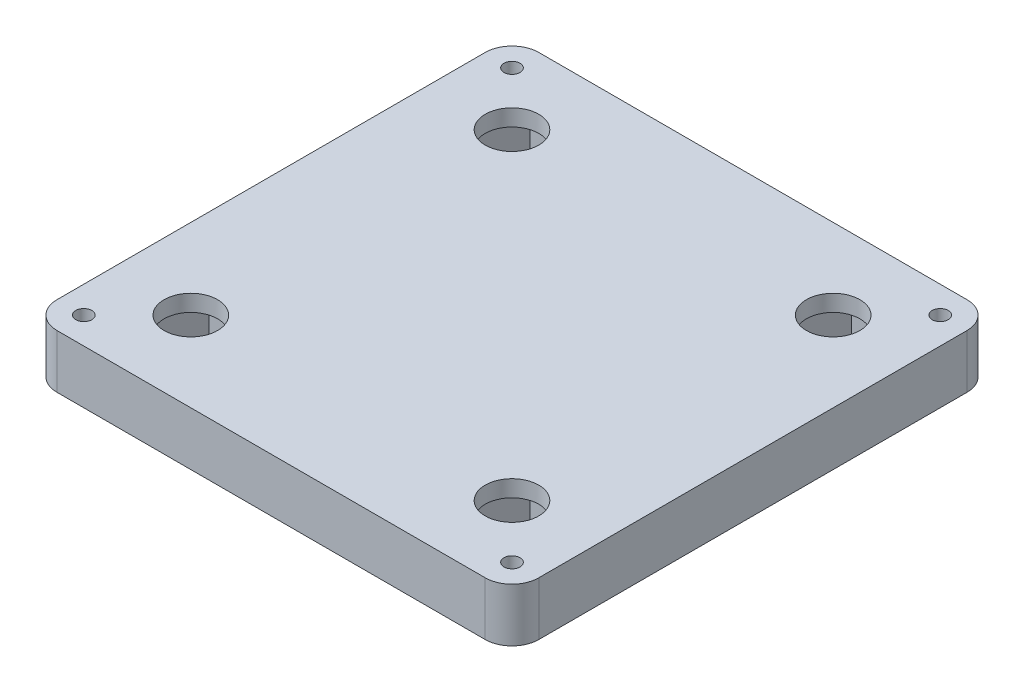
from build123d import *

# Parameters (mm, degrees)
SKETCH1_W           = 90
SKETCH1_H           = 90
BOSS_EXTRUDE1_DEPTH = 10
CUT_EXTRUDE1_DEPTH  = 6.9
SKETCH3_R           = 1.5
CUT_EXTRUDE2_DEPTH  = 65.420493634
SKETCH4_R           = 5
CUT_EXTRUDE3_DEPTH  = 65.420493634
CUT_EXTRUDE4_DEPTH  = 6.9
FILLET1_R           = 5


with BuildPart() as part:
    # Sketch1 → Boss-Extrude1 (new body)
    with BuildSketch(Plane(origin=(0, 0, 0), x_dir=(1, 0, 0), z_dir=(0, 1, 0))):
        Rectangle(SKETCH1_W, SKETCH1_H)
    extrude(amount=BOSS_EXTRUDE1_DEPTH)

    # Sketch2 → Cut-Extrude1 (cut)
    with BuildSketch(Plane.XZ):
        Polygon((4.618802154, -8), (9.237604307, 0), (4.618802154, 8), (-4.618802154, 8), (-9.237604307, 0), (-4.618802154, -8), align=None)
        with BuildLine():
            Line((-15.286801604, 8.754828956), (-12.02081528, 12.02081528))
            ThreePointArc((-12.02081528, 12.02081528), (12.02081528, 12.02081528), (12.02081528, -12.02081528))
            Line((12.02081528, -12.02081528), (8.754828956, -15.286801604))
            Line((8.754828956, -15.286801604), (11.145696882, -24.209642177))
            Line((11.145696882, -24.209642177), (20.068537455, -26.600510103))
            Line((20.068537455, -26.600510103), (23.334523779, -23.334523779))
            ThreePointArc((23.334523779, -23.334523779), (23.334523779, 23.334523779), (-23.334523779, 23.334523779))
            Line((-23.334523779, 23.334523779), (-26.600510103, 20.068537455))
            Line((-26.600510103, 20.068537455), (-24.209642177, 11.145696882))
            Line((-24.209642177, 11.145696882), (-15.286801604, 8.754828956))
        make_face()
    extrude(amount=-CUT_EXTRUDE1_DEPTH, mode=Mode.SUBTRACT)

    # Sketch3 → Cut-Extrude2 (cut, through all)
    with BuildSketch(Plane(origin=(0, 10, 0), x_dir=(1, 0, 0), z_dir=(0, 1, 0))):
        with Locations((-40, 40)):
            Circle(SKETCH3_R)
        with Locations((40, 40)):
            Circle(SKETCH3_R)
        with Locations((40, -40)):
            Circle(SKETCH3_R)
        with Locations((-40, -40)):
            Circle(SKETCH3_R)
    extrude(amount=-CUT_EXTRUDE2_DEPTH, mode=Mode.SUBTRACT)

    # Sketch4 → Cut-Extrude3 (cut, through all)
    with BuildSketch(Plane(origin=(0, 10, 0), x_dir=(1, 0, 0), z_dir=(0, 1, 0))):
        with Locations((-30, 30)):
            Circle(SKETCH4_R)
        with Locations((30, 30)):
            Circle(SKETCH4_R)
        with Locations((30, -30)):
            Circle(SKETCH4_R)
        with Locations((-30, -30)):
            Circle(SKETCH4_R)
    extrude(amount=-CUT_EXTRUDE3_DEPTH, mode=Mode.SUBTRACT)

    # Sketch6 → Cut-Extrude4 (cut)
    with BuildSketch(Plane.XZ):
        Polygon((-25.381197846, 22), (-20.762395693, 30), (-25.381197846, 38), (-34.618802154, 38), (-39.237604307, 30), (-34.618802154, 22), align=None)
        Polygon((34.618802154, 22), (39.237604307, 30), (34.618802154, 38), (25.381197846, 38), (20.762395693, 30), (25.381197846, 22), align=None)
        Polygon((34.618802154, -38), (39.237604307, -30), (34.618802154, -22), (25.381197846, -22), (20.762395693, -30), (25.381197846, -38), align=None)
        Polygon((-20.762395693, -30), (-25.381197846, -22), (-34.618802154, -22), (-39.237604307, -30), (-34.618802154, -38), (-25.381197846, -38), align=None)
    extrude(amount=-CUT_EXTRUDE4_DEPTH, mode=Mode.SUBTRACT)

    # Fillet1
    fillet1_edges = [part.edges().sort_by_distance(p)[0] for p in [
        (-45, 5, 45),
        (-45, 5, -45),
        (45, 5, 45),
        (45, 5, -45),
    ]]
    fillet(fillet1_edges, radius=FILLET1_R)


solid = part.part
